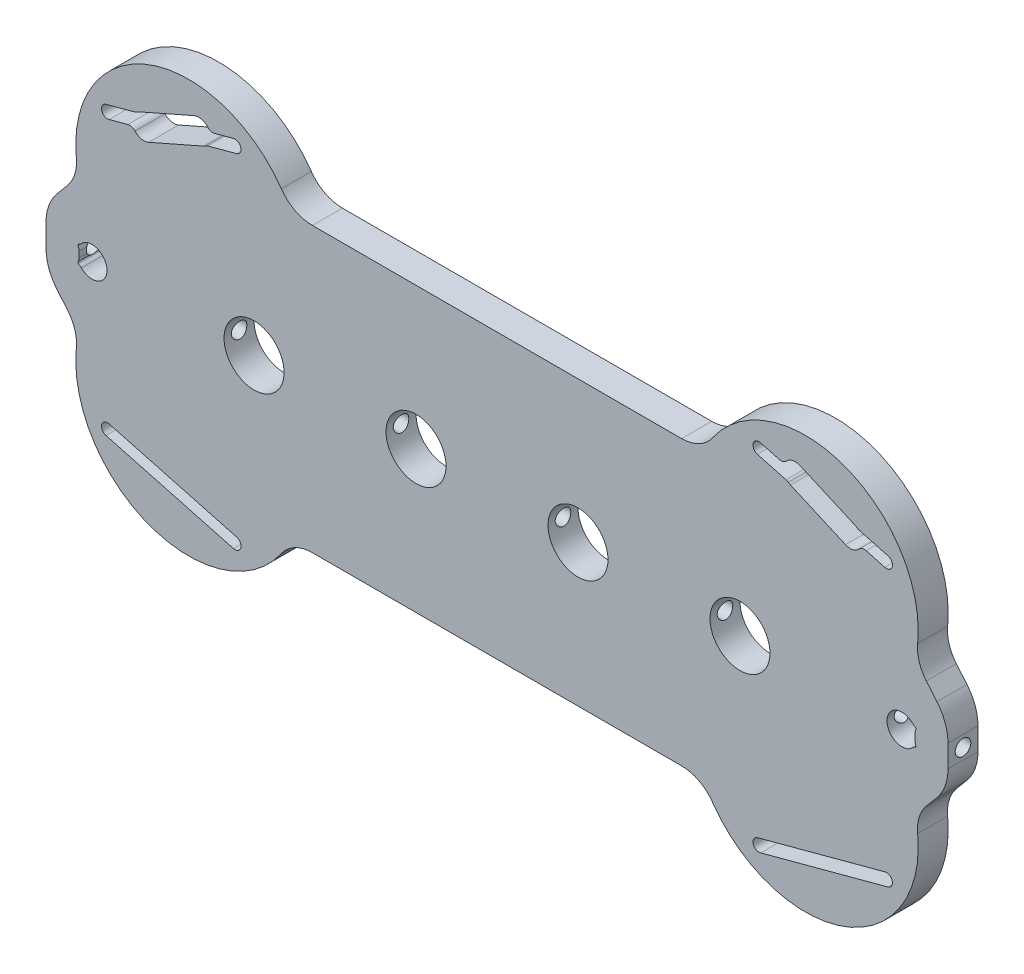
from build123d import *

# Parameters (mm, degrees)
SKETCH1_R               = 6.35
BOSS_EXTRUDE1_DEPTH     = 3.175
FILLET1_R               = 2
FILLET2_R               = 10
FILLET3_R               = 20
M4X0_7_TAPPED_HOLE1_D   = 3.3
BOSS_EXTRUDE2_DEPTH     = 3.175
FILLET4_R               = 8
CUT_EXTRUDE1_DEPTH      = 106.050630305
CUT_EXTRUDE1_DEPTH_BACK = 106.050630305
FILLET5_R               = 1.5


with BuildPart() as part:
    # Sketch1 → Boss-Extrude1 (new, symmetric)
    with BuildSketch(Plane.XY):
        Polygon((75.336239509, 30), (-75.336239509, 30), (-95.474630657, 6), (-95.474630657, -6), (-75.336239509, -30), (75.336239509, -30), (95.474630657, -6), (95.474630657, 6), align=None)
        with BuildLine():
            Line((-88.474630657, -1.3375), (-88.474630657, 1.3375))
            ThreePointArc((-88.474630657, 1.3375), (-88.714791341, 1.656946712), (-88.341203698, 1.798917233))
            ThreePointArc((-88.341203698, 1.798917233), (-82.55, 0), (-88.341203698, -1.798917233))
            ThreePointArc((-88.341203698, -1.798917233), (-88.714791341, -1.656946712), (-88.474630657, -1.3375))
        make_face(mode=Mode.SUBTRACT)
        with Locations((-51.435, 0)):
            Circle(SKETCH1_R, mode=Mode.SUBTRACT)
        with Locations((-17.145, 0)):
            Circle(SKETCH1_R, mode=Mode.SUBTRACT)
        with Locations((17.145, 0)):
            Circle(SKETCH1_R, mode=Mode.SUBTRACT)
        with Locations((51.435, 0)):
            Circle(SKETCH1_R, mode=Mode.SUBTRACT)
        with BuildLine():
            ThreePointArc((88.341203698, 1.798917233), (88.714791341, 1.656946712), (88.474630657, 1.3375))
            Line((88.474630657, 1.3375), (88.474630657, -1.3375))
            ThreePointArc((88.474630657, -1.3375), (88.714791341, -1.656946712), (88.341203698, -1.798917233))
            ThreePointArc((88.341203698, -1.798917233), (82.55, 0), (88.341203698, 1.798917233))
        make_face(mode=Mode.SUBTRACT)
    extrude(amount=BOSS_EXTRUDE1_DEPTH, both=True)

    # Fillet1
    fillet1_edges = [part.edges().sort_by_distance(p)[0] for p in [
        (-88.341203698, 1.798917233, 0),
        (88.341203698, -1.798917233, 0),
        (88.474630657, -1.3375, 0),
        (88.474630657, 1.3375, 0),
        (88.341203698, 1.798917233, 0),
        (-88.341203698, -1.798917233, 0),
        (-88.474630657, -1.3375, 0),
        (-88.474630657, 1.3375, 0),
    ]]
    fillet(fillet1_edges, radius=FILLET1_R)

    # Fillet2
    fillet2_edges = [part.edges().sort_by_distance(p)[0] for p in [
        (-95.474630657, -6, 0),
        (-95.474630657, 6, 0),
        (95.474630657, -6, 0),
        (95.474630657, 6, 0),
    ]]
    fillet(fillet2_edges, radius=FILLET2_R)

    # Fillet3
    fillet3_edges = [part.edges().sort_by_distance(p)[0] for p in [
        (-75.336239509, 30, 0),
        (-75.336239509, -30, 0),
        (75.336239509, -30, 0),
        (75.336239509, 30, 0),
    ]]
    fillet(fillet3_edges, radius=FILLET3_R)

    # M4x0.7 Tapped Hole1 (through all)
    with Locations(Plane.ZY.offset(95.474630657)):
        with Locations((0, 0)):
            Hole(M4X0_7_TAPPED_HOLE1_D / 2)

    # Sketch5 → Boss-Extrude2 (add, symmetric)
    # profile 1 of 4: a face of its own
    with BuildSketch(Plane.XY):
        with BuildLine():
            Line((-43.665967611, 30), (-88.525028191, 14.282213706))
            ThreePointArc((-88.525028191, 14.282213706), (-73.180209359, 42.361098049), (-43.665967611, 30))
        make_face()
        with BuildLine():
            Line((-73.761176383, 27.904785334), (-62.135148054, 33.016092926))
            ThreePointArc((-62.135148054, 33.016092926), (-60.852722712, 36.310844091), (-64.147473877, 37.593269433))
            Line((-64.147473877, 37.593269433), (-75.773502206, 32.481961842))
            ThreePointArc((-75.773502206, 32.481961842), (-77.055927548, 29.187210676), (-73.761176383, 27.904785334))
        make_face(mode=Mode.SUBTRACT)
    # profile 2 of 4: a face of its own
    with BuildSketch(Plane.XY):
        with BuildLine():
            Line((43.665967611, 30), (88.525028191, 14.282213706))
            ThreePointArc((88.525028191, 14.282213706), (73.180209359, 42.361098049), (43.665967611, 30))
        make_face()
        with BuildLine():
            Line((75.773502206, 32.481961842), (64.147473877, 37.593269433))
            ThreePointArc((64.147473877, 37.593269433), (60.852722712, 36.310844091), (62.135148054, 33.016092926))
            Line((62.135148054, 33.016092926), (73.761176383, 27.904785334))
            ThreePointArc((73.761176383, 27.904785334), (77.055927548, 29.187210676), (75.773502206, 32.481961842))
        make_face(mode=Mode.SUBTRACT)
    # profile 3 of 4: a face of its own
    with BuildSketch(Plane.XY):
        with BuildLine():
            Line((-43.665967611, -30), (-88.525028191, -14.282213706))
            ThreePointArc((-88.525028191, -14.282213706), (-73.180209359, -42.361098049), (-43.665967611, -30))
        make_face()
    # profile 4 of 4: a face of its own
    with BuildSketch(Plane.XY):
        with BuildLine():
            Line((43.665967611, -30), (88.525028191, -14.282213706))
            ThreePointArc((88.525028191, -14.282213706), (73.180209359, -42.361098049), (43.665967611, -30))
        make_face()
    extrude(amount=BOSS_EXTRUDE2_DEPTH, both=True)

    # Fillet4
    fillet4_edges = [part.edges().sort_by_distance(p)[0] for p in [
        (-88.525028191, 14.282213706, 0),
        (-43.665967611, 30, 0),
        (43.665967611, 30, 0),
        (88.525028191, 14.282213706, 0),
        (-88.525028191, -14.282213706, 0),
        (-43.665967611, -30, 0),
        (43.665967611, -30, 0),
        (88.525028191, -14.282213706, 0),
    ]]
    fillet(fillet4_edges, radius=FILLET4_R)

    # Sketch6 → Cut-Extrude1 (cut, two sides: drawn at the far end of the back side and taken through both)
    with BuildSketch(Plane.XY.offset(-CUT_EXTRUDE1_DEPTH_BACK)):
        with BuildLine():
            Line((-61.479274079, 33.437160527), (-55.13164115, 35.138003644))
            ThreePointArc((-55.13164115, 35.138003644), (-54.233615538, 36.693429631), (-55.789041524, 37.591455243))
            Line((-55.789041524, 37.591455243), (-60.823832261, 36.242387131))
            ThreePointArc((-60.823832261, 36.242387131), (-62.199977855, 37.620688946), (-64.147473877, 37.593269433))
            Line((-64.147473877, 37.593269433), (-75.773502206, 32.481961842))
            ThreePointArc((-75.773502206, 32.481961842), (-76.117949165, 32.29714472), (-76.429376182, 32.06089424))
            Line((-76.429376182, 32.06089424), (-82.777009111, 30.360051123))
            ThreePointArc((-82.777009111, 30.360051123), (-83.675034723, 28.804625136), (-82.119608736, 27.906599524))
            Line((-82.119608736, 27.906599524), (-77.084818, 29.255667636))
            ThreePointArc((-77.084818, 29.255667636), (-75.708672406, 27.877365822), (-73.761176383, 27.904785334))
            Line((-73.761176383, 27.904785334), (-62.135148054, 33.016092926))
            ThreePointArc((-62.135148054, 33.016092926), (-61.790701095, 33.200910047), (-61.479274079, 33.437160527))
        make_face()
        with BuildLine():
            ThreePointArc((55.789041524, 37.591455243), (54.233615538, 36.693429631), (55.13164115, 35.138003644))
            Line((55.13164115, 35.138003644), (61.479274079, 33.437160527))
            ThreePointArc((61.479274079, 33.437160527), (61.790701095, 33.200910047), (62.135148054, 33.016092926))
            Line((62.135148054, 33.016092926), (73.761176383, 27.904785334))
            ThreePointArc((73.761176383, 27.904785334), (75.708672406, 27.877365822), (77.084818, 29.255667636))
            Line((77.084818, 29.255667636), (82.119608736, 27.906599524))
            ThreePointArc((82.119608736, 27.906599524), (83.675034723, 28.804625136), (82.777009111, 30.360051123))
            Line((82.777009111, 30.360051123), (76.429376182, 32.06089424))
            ThreePointArc((76.429376182, 32.06089424), (76.117949165, 32.29714472), (75.773502206, 32.481961842))
            Line((75.773502206, 32.481961842), (64.147473877, 37.593269433))
            ThreePointArc((64.147473877, 37.593269433), (62.199977855, 37.620688946), (60.823832261, 36.242387131))
            Line((60.823832261, 36.242387131), (55.789041524, 37.591455243))
        make_face()
        with BuildLine():
            Line((82.119608736, -27.906599524), (55.13164115, -35.138003644))
            ThreePointArc((55.13164115, -35.138003644), (54.233615538, -36.693429631), (55.789041524, -37.591455243))
            Line((55.789041524, -37.591455243), (82.777009111, -30.360051123))
            ThreePointArc((82.777009111, -30.360051123), (83.675034723, -28.804625136), (82.119608736, -27.906599524))
        make_face()
        with BuildLine():
            ThreePointArc((-55.789041524, -37.591455243), (-54.233615538, -36.693429631), (-55.13164115, -35.138003644))
            Line((-55.13164115, -35.138003644), (-82.119608736, -27.906599524))
            ThreePointArc((-82.119608736, -27.906599524), (-83.675034723, -28.804625136), (-82.777009111, -30.360051123))
            Line((-82.777009111, -30.360051123), (-55.789041524, -37.591455243))
        make_face()
    extrude(amount=CUT_EXTRUDE1_DEPTH + CUT_EXTRUDE1_DEPTH_BACK, mode=Mode.SUBTRACT)

    # Fillet5
    fillet5_edges = [part.edges().sort_by_distance(p)[0] for p in [
        (-60.823832261, 36.242387131, 0),
        (-76.429376182, 32.06089424, 0),
        (-77.084818, 29.255667636, 0),
        (-61.479274079, 33.437160527, 0),
        (61.479274079, 33.437160527, 0),
        (60.823832261, 36.242387131, 0),
        (76.429376182, 32.06089424, 0),
        (77.084818, 29.255667636, 0),
    ]]
    fillet(fillet5_edges, radius=FILLET5_R)


solid = part.part
